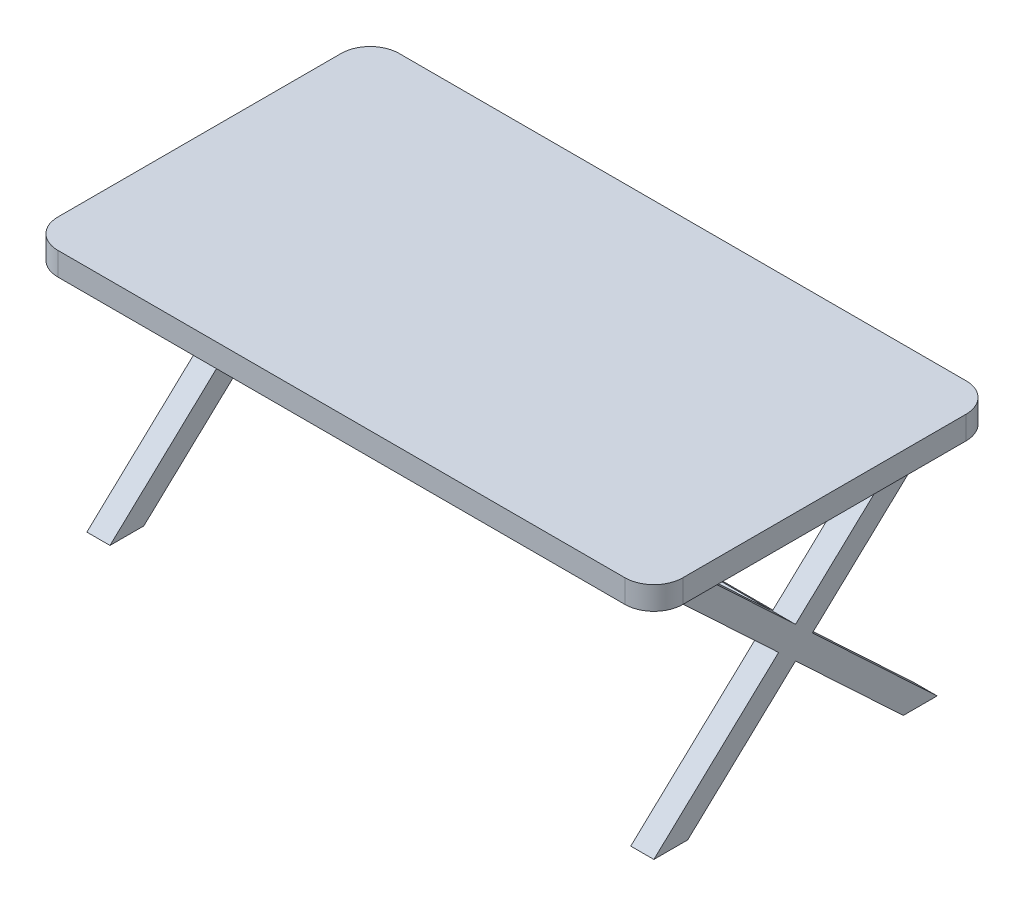
from build123d import *

# Parameters (mm, degrees)
BOSS_EXTRUDE1_DEPTH = 80
SKETCH2_W           = 150
SKETCH2_H           = 116.96913173
SKETCH2_R           = 5
BASE_FLANGE1_DEPTH  = 5
BOSS_EXTRUDE2_START = -80
BOSS_EXTRUDE2_DEPTH = 1800
BOSS_EXTRUDE3_DEPTH = 80


# Sheet-metal steps are written as plain solids
with BuildPart() as part:
    # Sketch1 → Boss-Extrude1 (new body)
    with BuildSketch(Plane(origin=(0, 0, 0), x_dir=(0, 0, -1), z_dir=(1, 0, 0))):
        Polygon((-372.642354845, -404.181488166), (0, -54.829280499), (372.642354845, -404.181488166), (489.611486575, -404.181488166), (58.484565865, 0), (489.611486575, 404.181488166), (372.642354845, 404.181488166), (0, 54.829280499), (-372.642354845, 404.181488166), (-489.611486575, 404.181488166), (-58.484565865, 0), (-489.611486575, -404.181488166), align=None)
    extrude(amount=BOSS_EXTRUDE1_DEPTH)


with BuildPart() as body_2:
    # Mirror2: mirrored copy
    add(part.part.mirror(Plane(origin=(980, 0, 0), x_dir=(0, 0, 1), z_dir=(1, 0, 0))))


with BuildPart() as body_3:
    # Sketch2 → Base-Flange1 (new body)
    with BuildSketch(Plane(origin=(0, 404.181488166, 0), x_dir=(1, 0, 0), z_dir=(0, 1, 0))):
        with Locations((75, 431.12692071)):
            Rectangle(SKETCH2_W, SKETCH2_H)
        with Locations(Location((115, 459.611486575, 0), (0, 0, 270))):
            Circle(SKETCH2_R, mode=Mode.SUBTRACT)
        with Locations(Location((115, 430.642354845, 0), (0, 0, 270))):
            Circle(SKETCH2_R, mode=Mode.SUBTRACT)
        with Locations(Location((115, 402.642354845, 0), (0, 0, 270))):
            Circle(SKETCH2_R, mode=Mode.SUBTRACT)
    extrude(amount=BASE_FLANGE1_DEPTH)


with BuildPart() as body_4:
    # Mirror3: mirrored copy
    add(body_3.part.mirror(Plane(origin=(980, 0, 0), x_dir=(0, 0, 1), z_dir=(1, 0, 0))))


with BuildPart() as body_5:
    # Mirror4: mirrored copy
    add(body_4.part.mirror(Plane.XY))


with BuildPart() as body_6:
    # Mirror4 2: mirrored copy
    add(body_3.part.mirror(Plane.XY))


with BuildPart() as part_1:
    add(part.part)

    add(body_2.part)  # Boss-Extrude2 merges body 2
    # Sketch13 → Boss-Extrude2 (add)
    with BuildSketch(Plane(origin=(1960, 0, 0), x_dir=(0, 0, -1), z_dir=(1, 0, 0)).offset(BOSS_EXTRUDE2_START)):
        Polygon((0, 54.829280499), (-58.484565865, 0), (0, -54.829280499), (58.484565865, 0), align=None)
    extrude(amount=-BOSS_EXTRUDE2_DEPTH)


with BuildPart() as body_6_2:
    # Sketch14 → Boss-Extrude3 (new body)
    with BuildSketch(Plane(origin=(0, 409.181488166, 0), x_dir=(1, 0, 0), z_dir=(0, 1, 0))):
        with BuildLine():
            Line((0, 589.611486575), (1960, 589.611486575))
            ThreePointArc((1960, 589.611486575), (2030.710678119, 560.322164694), (2060, 489.611486575))
            Line((2060, 489.611486575), (2060, -489.611486575))
            ThreePointArc((2060, -489.611486575), (2030.710678119, -560.322164694), (1960, -589.611486575))
            Line((1960, -589.611486575), (0, -589.611486575))
            ThreePointArc((0, -589.611486575), (-70.710678119, -560.322164694), (-100, -489.611486575))
            Line((-100, -489.611486575), (-100, 489.611486575))
            ThreePointArc((-100, 489.611486575), (-70.710678119, 560.322164694), (0, 589.611486575))
        make_face()
    extrude(amount=BOSS_EXTRUDE3_DEPTH)


solid = Compound([body_3.part, body_4.part, body_5.part, body_6.part, part_1.part, body_6_2.part])
